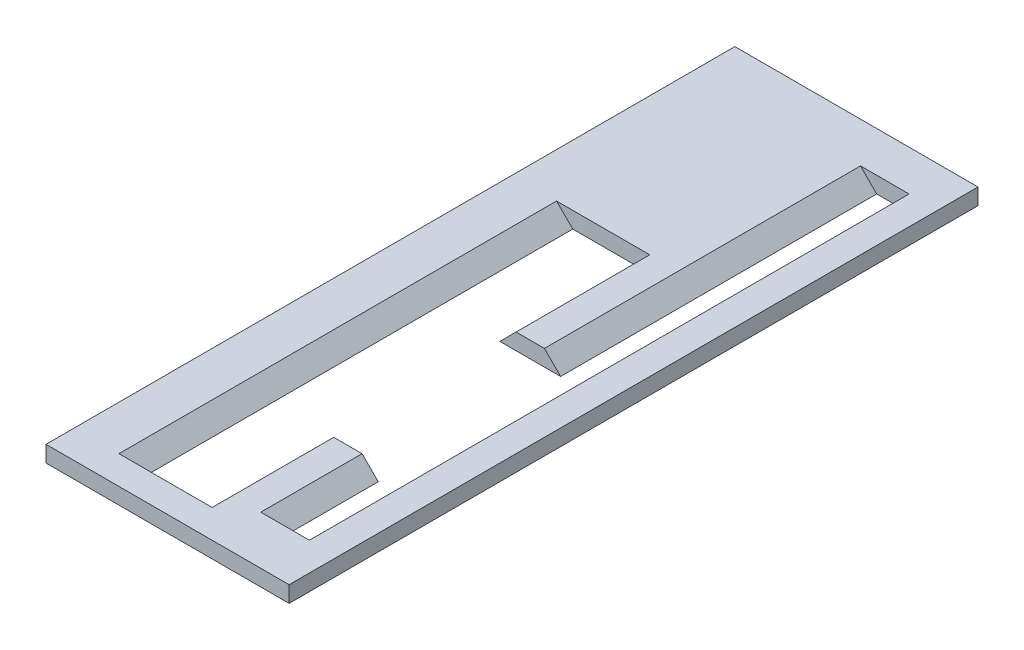
from build123d import *

# Parameters (mm, degrees)
DODANIE_WYCI_GNI_CIE1_DEPTH   = 110
DODANIE_WYCI_GNI_CIE1_2_DEPTH = 110
SZKIC2_W                      = 45
SZKIC2_H                      = 5
DODANIE_WYCI_GNI_CIE2_DEPTH   = 4
SZKIC4_W                      = 35
SZKIC4_H                      = 30
WYTNIJ_WYCI_GNI_CIE1_DEPTH    = 10
SZKIC5_W                      = 45
SZKIC5_H                      = 50
DODANIE_WYCI_GNI_CIE3_DEPTH   = 4
SZKIC6_W                      = 4
SZKIC6_H                      = 148
WYTNIJ_WYCI_GNI_CIE2_DEPTH    = 10
SFAZOWANIE1_SIZE              = 4
DODANIE_WYCI_GNI_CIE4_DEPTH   = 2
SZKIC9_W                      = 15
SZKIC9_H                      = 45
WYTNIJ_WYCI_GNI_CIE3_DEPTH    = 80


with BuildPart() as part:
    # Szkic1 → Dodanie-wyciągnięcie1 (new body)
    with BuildSketch(Plane.XY):
        Polygon((-7.5, -2), (-11.5, 2), (-22.5, 2), (-22.5, -2), align=None)
    extrude(amount=-DODANIE_WYCI_GNI_CIE1_DEPTH)



with BuildPart() as body_2:
    # Szkic1 → Dodanie-wyci_gni_cie1 2 (new body)
    with BuildSketch(Plane.XY):
        Polygon((22.5, 2), (11.5, 2), (7.5, -2), (22.5, -2), align=None)
    extrude(amount=-DODANIE_WYCI_GNI_CIE1_2_DEPTH)


with BuildPart() as part_1:
    add(part.part)

    add(body_2.part)  # Dodanie-wyciągnięcie2 merges body 2
    # Szkic2 → Dodanie-wyciągnięcie2 (add)
    with BuildSketch(Plane.XZ.offset(2)):
        with Locations((0, 2.5)):
            Rectangle(SZKIC2_W, SZKIC2_H)
        with Locations((0, -112.5)):
            Rectangle(SZKIC2_W, SZKIC2_H)
    extrude(amount=-DODANIE_WYCI_GNI_CIE2_DEPTH)

    # Szkic4 → Wytnij-wyciągnięcie1 (cut)
    with BuildSketch(Plane(origin=(0, 2, 0), x_dir=(1, 0, 0), z_dir=(0, 1, 0))):
        with Locations((22.5, 55)):
            Rectangle(SZKIC4_W, SZKIC4_H)
    extrude(amount=-WYTNIJ_WYCI_GNI_CIE1_DEPTH, mode=Mode.SUBTRACT)

    # Szkic5 → Dodanie-wyciągnięcie3 (add)
    with BuildSketch(Plane.XZ.offset(2)):
        with Locations((0, -140)):
            Rectangle(SZKIC5_W, SZKIC5_H)
        Polygon((37.5, 5), (22.5, 5), (22.5, -40), (22.5, -70), (22.5, -115), (22.5, -165), (37.5, -165), align=None)
    extrude(amount=-DODANIE_WYCI_GNI_CIE3_DEPTH)

    # Szkic6 → Wytnij-wyciągnięcie2 (cut)
    with BuildSketch(Plane(origin=(0, 2, 0), x_dir=(1, 0, 0), z_dir=(0, 1, 0))):
        with Locations((24.5, 81)):
            Rectangle(SZKIC6_W, SZKIC6_H)
    extrude(amount=-WYTNIJ_WYCI_GNI_CIE2_DEPTH, mode=Mode.SUBTRACT)

    # Sfazowanie1
    sfazowanie1_edges = [part_1.edges().sort_by_distance(p)[0] for p in [
        (22.5, 2, -23.5),
        (22.5, 2, -112.5),
        (26.5, 2, -81),
    ]]
    chamfer(sfazowanie1_edges, length=SFAZOWANIE1_SIZE - 0.0001)  # a hair under: the kernel refuses the full size

    # Szkic7 → Dodanie-wyciągnięcie4 (add)
    with BuildSketch(Plane(origin=(0, 0, 0), x_dir=(-1, 0, 0), z_dir=(0, 0, -1))):
        Polygon((-11.5, 2), (-7.5, -2), (7.5, -2), (11.5, 2), align=None)
    extrude(amount=DODANIE_WYCI_GNI_CIE4_DEPTH)

    # Szkic9 → Wytnij-wyciągnięcie3 (cut)
    with BuildSketch(Plane.XZ.offset(2)):
        with Locations((15, -54.5)):
            Rectangle(SZKIC9_W, SZKIC9_H)
    extrude(amount=-WYTNIJ_WYCI_GNI_CIE3_DEPTH, mode=Mode.SUBTRACT)


solid = part_1.part
